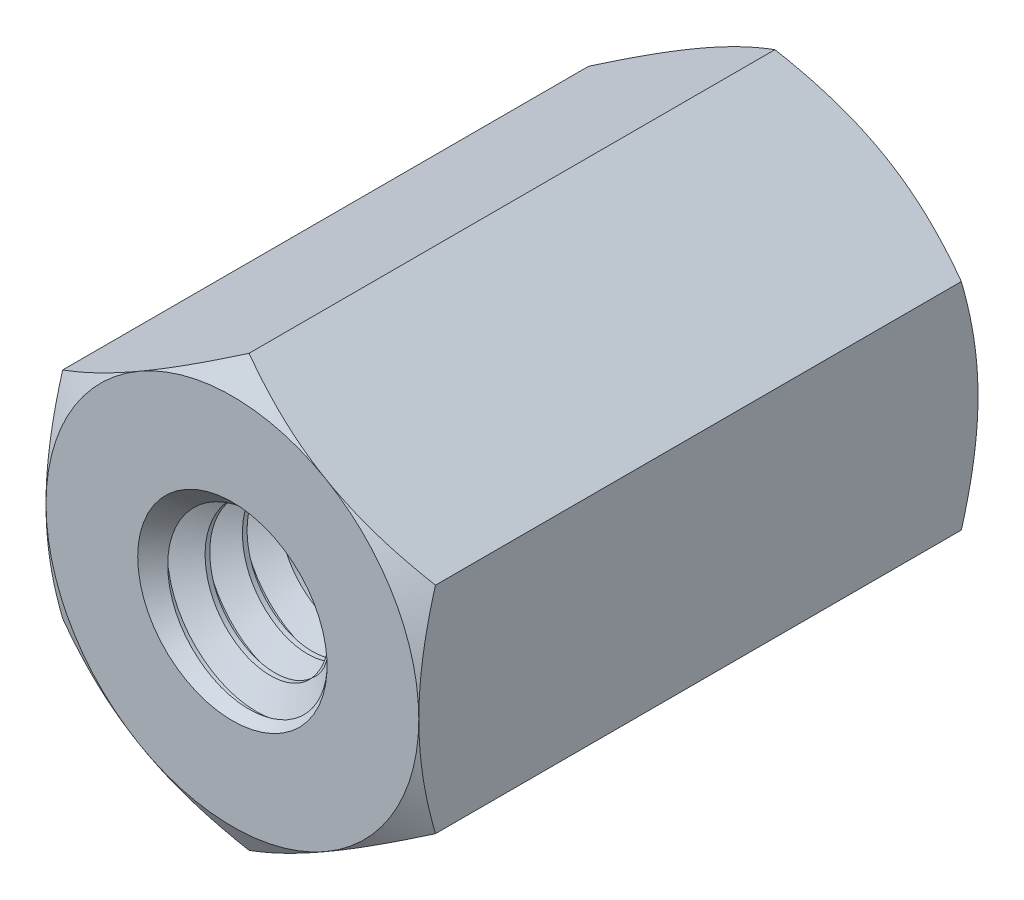
from build123d import *

# Parameters (mm, degrees)
EXTRUDE1_DEPTH          = 9.525
EXTRUDE1_DEPTH_BACK     = 9.525
SKETCH1_R               = 3.175
SWEEP1_PITCH            = 1.27
EXTRUDE2_DEPTH          = 23.516555669
SKETCH8_OUTSIDE_W       = 101.782
SKETCH8_OUTSIDE_H       = 103.746
SKETCH8_OUTSIDE_R       = 6.35
EXTRUDE4_DEPTH          = 23.516555669
EXTRUDE4_DRAFT          = -60
MIRROR1_COPY_1_SKETCH_W = 101.782
MIRROR1_COPY_1_SKETCH_H = 103.746
MIRROR1_COPY_1_SKETCH_R = 6.35
MIRROR1_COPY_1_DEPTH    = 23.516555669
MIRROR1_COPY_1_DRAFT    = -60


with BuildPart() as part:
    # Sketch1 → Extrude1 (new, two sides: drawn at the far end of the back side and taken through both)
    with BuildSketch(Plane.XY.offset(-EXTRUDE1_DEPTH_BACK)):
        Polygon((0, 7.332348419), (-6.35, 3.666174209), (-6.35, -3.666174209), (0, -7.332348419), (6.35, -3.666174209), (6.35, 3.666174209), align=None)
        with Locations(Location((0, 0, 0), (0, 0, 180))):
            Circle(SKETCH1_R, mode=Mode.SUBTRACT)
    extrude(amount=EXTRUDE1_DEPTH + EXTRUDE1_DEPTH_BACK)

    # Sweep1: the profile of Sketch12 profile screwed along a right-hand helix of 16 turns, 8 arcs to a turn; built about Z, then put on its axis
    sweep1_z = Axis((0, 0, 0), (0, 0, 1))
    sweep1_corners = [(3.1753, 0, -1.111423205), (3.1753, 0, 0.000173205), (2.350110803, 0, -0.47625), (2.350110803, 0, -0.635)]
    with BuildLine(mode=Mode.PRIVATE) as sweep1_profile:
        Line(sweep1_corners[0], sweep1_corners[1])
        Line(sweep1_corners[1], sweep1_corners[2])
        Line(sweep1_corners[2], sweep1_corners[3])
        Line(sweep1_corners[3], sweep1_corners[0])
    sweep1_cap = Face(sweep1_profile.wire())
    sweep1_turn_angles = [0, 22.5, 45, 67.5, 90, 112.5, 135, 157.5, 180, 202.5, 225, 247.5, 270, 292.5, 315, 337.5, 360]
    sweep1_turn_weights = [1, 0.9238795325112867, 1, 0.9238795325112867, 1, 0.9238795325112867, 1, 0.9238795325112867, 1, 0.9238795325112867, 1, 0.9238795325112867, 1, 0.9238795325112867, 1, 0.9238795325112867, 1]
    sweep1_turn_rails = [Edge.make_bspline([Vector(p[0], p[1], 0).rotate(sweep1_z, sweep1_turn_angles[k]) / sweep1_turn_weights[k] + Vector(0, 0, p[2] + SWEEP1_PITCH * sweep1_turn_angles[k] / 360) for k in range(17)], [0, 0, 0, 1, 1, 2, 2, 3, 3, 4, 4, 5, 5, 6, 6, 7, 7, 8, 8, 8], 2, sweep1_turn_weights) for p in sweep1_corners]
    sweep1_turn_sides = [Face.make_surface_from_curves(sweep1_turn_rails[p[0]], sweep1_turn_rails[p[1]]) for p in [(0, 1), (1, 2), (2, 3), (3, 0)]]
    sweep1 = Plane(origin=(0, 0, -9.525), x_dir=(0, 1, 0), z_dir=(0, 0, 1)) * Solid(Shell([*[p.moved(Location((0, 0, SWEEP1_PITCH * i))) for i in range(16) for p in sweep1_turn_sides], sweep1_cap, sweep1_cap.rotate(sweep1_z, 5760).moved(Location((0, 0, SWEEP1_PITCH * 5760 / 360)))]))
    add(sweep1)

    # Sketch6 → Extrude2 (cut, through all)
    with BuildSketch(Plane(origin=(0, 0, -9.525), x_dir=(-1, 0, 0), z_dir=(0, 0, -1))):
        Polygon((0, 7.332348419), (-6.35, 3.666174209), (-6.35, -3.666174209), (0, -7.332348419), (6.35, -3.666174209), (6.35, 3.666174209), align=None)
    extrude2 = extrude(amount=EXTRUDE2_DEPTH, mode=Mode.SUBTRACT)

    # Extrude3 cone 1 section (through the dimple's axis) → Extrude3 (revolve, cut)
    with BuildSketch(Plane(origin=(0, 0, -9.525), x_dir=(0, 1, 0), z_dir=(1, 0, 0))):
        Polygon((0, 0), (3.2258, 0), (0, 3.459246985), align=None)
    extrude3 = revolve(axis=Axis((0, 0, -9.525), (0, 0, 1)), mode=Mode.SUBTRACT)


with BuildPart() as extrude4_tool:
    # Sketch8 outside → Extrude4 (with draft: the straight prism first)
    with BuildSketch(Plane(origin=(0, 0, -9.525), x_dir=(-1, 0, 0), z_dir=(0, 0, -1))):
        Rectangle(SKETCH8_OUTSIDE_W, SKETCH8_OUTSIDE_H)
        Circle(SKETCH8_OUTSIDE_R, mode=Mode.SUBTRACT)
    extrude(amount=-EXTRUDE4_DEPTH)
    # Extrude4: the draft: its side faces are tilted about the plane it starts from
    extrude4_sides = [extrude4_tool.faces().sort_by_distance(p)[0] for p in [
        (0, -51.873, 2.233277835),
        (-50.891, 0, 2.233277835),
        (0, 51.873, 2.233277835),
        (50.891, 0, 2.233277835),
        (6.35, 0, 2.233277835),
    ]]
    draft(extrude4_sides, Plane(origin=(0, 0, -9.525), x_dir=(-1, 0, 0), z_dir=(0, 0, -1)), EXTRUDE4_DRAFT)


with BuildPart() as part_1:
    add(part.part)

    # Extrude4: cut by extrude4_tool
    add(extrude4_tool.part, mode=Mode.SUBTRACT)

    # Mirror1: Extrude2, Extrude3 across plane
    add(extrude2.mirror(Plane.XY), mode=Mode.SUBTRACT)
    add(extrude3.mirror(Plane.XY), mode=Mode.SUBTRACT)


with BuildPart() as mirror1_copy_1_tool:
    # Mirror1 copy 1 sketch → Mirror1 copy 1 (with draft: the straight prism first)
    with BuildSketch(Plane(origin=(0, 0, 9.525), x_dir=(-1, 0, 0), z_dir=(0, 0, 1))):
        Rectangle(MIRROR1_COPY_1_SKETCH_W, MIRROR1_COPY_1_SKETCH_H)
        Circle(MIRROR1_COPY_1_SKETCH_R, mode=Mode.SUBTRACT)
    extrude(amount=-MIRROR1_COPY_1_DEPTH)
    # Mirror1 copy 1: the draft: its side faces are tilted about the plane it starts from
    mirror1_copy_1_sides = [mirror1_copy_1_tool.faces().sort_by_distance(p)[0] for p in [
        (0, -51.873, -2.233277835),
        (-50.891, 0, -2.233277835),
        (0, 51.873, -2.233277835),
        (50.891, 0, -2.233277835),
        (6.35, 0, -2.233277835),
    ]]
    draft(mirror1_copy_1_sides, Plane(origin=(0, 0, 9.525), x_dir=(-1, 0, 0), z_dir=(0, 0, 1)), MIRROR1_COPY_1_DRAFT)


with BuildPart() as part_2:
    add(part_1.part)

    # Mirror1 copy 1: cut by mirror1_copy_1_tool
    add(mirror1_copy_1_tool.part, mode=Mode.SUBTRACT)


solid = part_2.part
